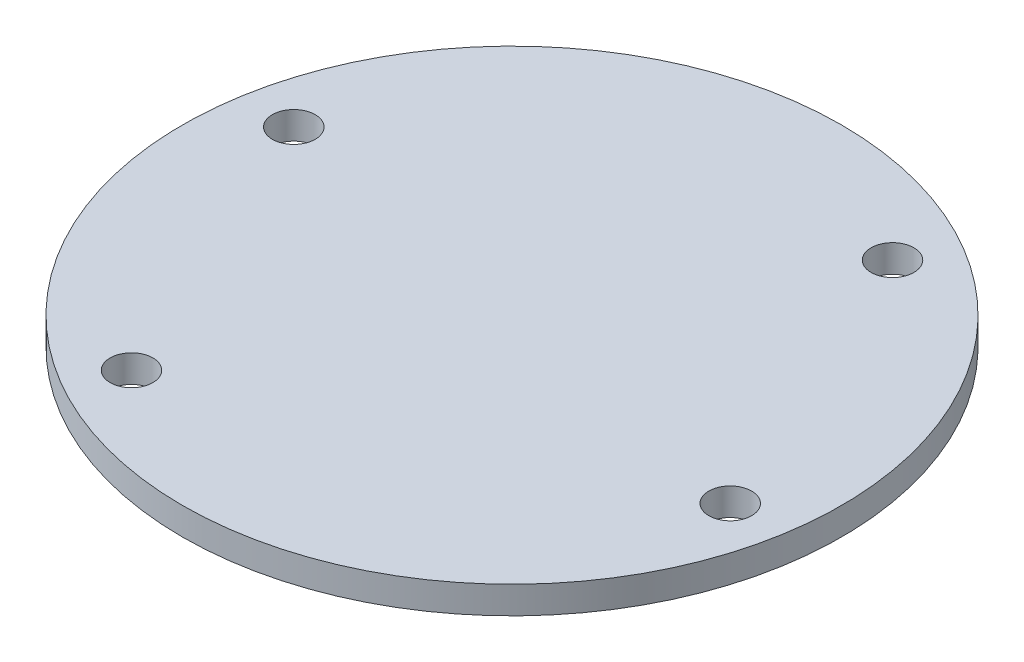
from build123d import *

# Parameters (mm, degrees)
SKETCH1_R           = 19.25
BOSS_EXTRUDE1_DEPTH = 1.6
SKETCH3_R           = 1.25
CUT_EXTRUDE1_DEPTH  = 28.270588553


with BuildPart() as part:
    # Sketch1 → Boss-Extrude1 (new body)
    with BuildSketch(Plane(origin=(0, 0, 0), x_dir=(1, 0, 0), z_dir=(0, 1, 0))):
        Circle(SKETCH1_R)
    extrude(amount=BOSS_EXTRUDE1_DEPTH)

    # Sketch3 → Cut-Extrude1 (cut, through all)
    with BuildSketch(Plane(origin=(0, 1.6, 0), x_dir=(1, 0, 0), z_dir=(0, 1, 0))):
        with Locations((-15.893816823, 3.147175209)):
            Circle(SKETCH3_R)
        with Locations((8.327072013, 13.89884612)):
            Circle(SKETCH3_R)
        with Locations((15.893815137, -3.147176833)):
            Circle(SKETCH3_R)
        with Locations((-8.327075386, -13.898849368)):
            Circle(SKETCH3_R)
    extrude(amount=-CUT_EXTRUDE1_DEPTH, mode=Mode.SUBTRACT)


solid = part.part
